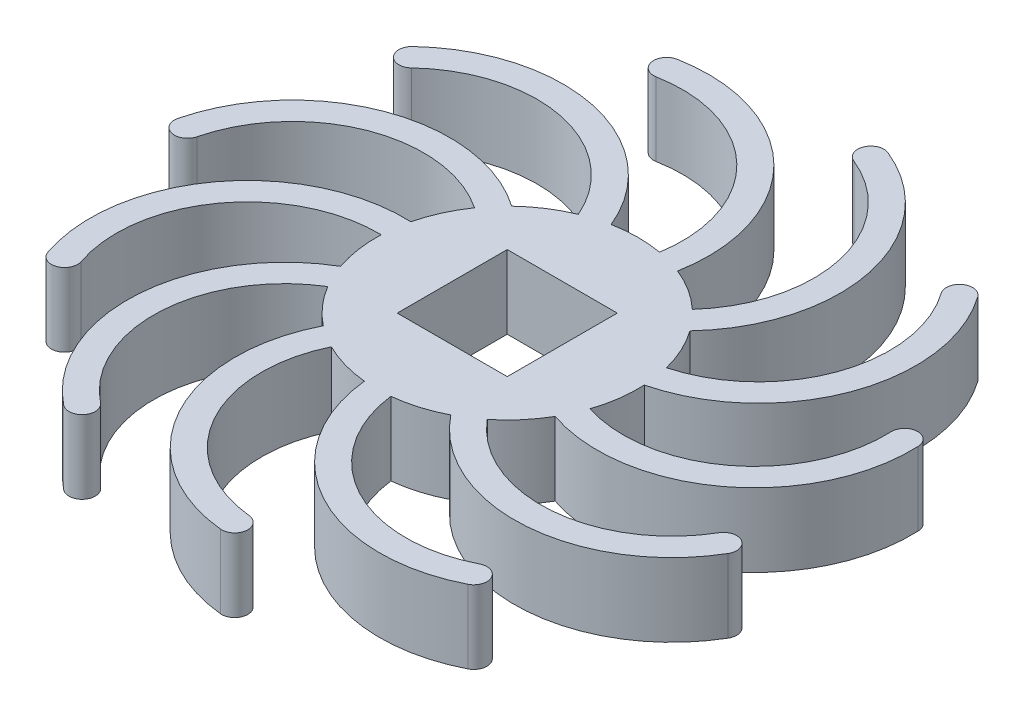
from build123d import *

# Parameters (mm, degrees)
SKETCH1_R           = 5
SKETCH1_W           = 4.2
SKETCH1_H           = 4.2
BOSS_EXTRUDE1_DEPTH = 2.8
BOSS_EXTRUDE5_DEPTH = 2.8


with BuildPart() as part:
    # Sketch1 → Boss-Extrude1 (new body)
    with BuildSketch(Plane(origin=(0, 0, 0), x_dir=(1, 0, 0), z_dir=(0, 1, 0))):
        Circle(SKETCH1_R)
        Rectangle(SKETCH1_W, SKETCH1_H, mode=Mode.SUBTRACT)
    extrude(amount=BOSS_EXTRUDE1_DEPTH)

    # Sketch2 → Boss-Extrude5 (add)
    with BuildSketch(Plane(origin=(0, 0, 0), x_dir=(1, 0, 0), z_dir=(0, 1, 0))):
        with BuildLine():
            ThreePointArc((-0.499297632, -4.680082759), (2.493631187, -9.560533326), (8.21668977, -9.712260432))
            ThreePointArc((8.21668977, -9.712260432), (8.43563539, -9.039904265), (7.763279223, -8.820958645))
            ThreePointArc((7.763279223, -8.820958645), (2.993631187, -8.694507923), (0.499297632, -4.627096918))
            ThreePointArc((0.499297632, -4.627096918), (-0.026492921, -4.154292207), (-0.499297632, -4.680082759))
        make_face()
        with BuildLine():
            ThreePointArc((-2.081561563, -4.162502309), (-2.182203058, -8.932764718), (1.76191578, -11.617808248))
            ThreePointArc((1.76191578, -11.617808248), (2.209166842, -12.165500212), (1.661474878, -12.612751274))
            ThreePointArc((1.661474878, -12.612751274), (-3.071038507, -9.39099124), (-2.950279665, -3.667195475))
            ThreePointArc((-2.950279665, -3.667195475), (-2.268267198, -3.480489841), (-2.081561563, -4.162502309))
        make_face()
        with BuildLine():
            ThreePointArc((-4.00153967, -2.376342627), (-6.665203252, -6.334931832), (-4.798843474, -10.72608582))
            ThreePointArc((-4.798843474, -10.72608582), (-4.718696569, -11.428635799), (-5.421246548, -11.508782704))
            ThreePointArc((-5.421246548, -11.508782704), (-7.660675174, -6.239875789), (-4.464568751, -1.489999539))
            ThreePointArc((-4.464568751, -1.489999539), (-3.789882666, -1.701656543), (-4.00153967, -2.376342627))
        make_face()
        with BuildLine():
            ThreePointArc((-4.651057205, 0.164289048), (-9.032048507, -1.725802849), (-9.836003832, -6.428906931))
            ThreePointArc((-9.836003832, -6.428906931), (-10.14840716, -7.063260271), (-10.7827605, -6.750856943))
            ThreePointArc((-10.7827605, -6.750856943), (-9.818101601, -1.107643863), (-4.561388803, 1.160260723))
            ThreePointArc((-4.561388803, 1.160260723), (-4.108237166, 0.617440684), (-4.651057205, 0.164289048))
        make_face()
        with BuildLine():
            ThreePointArc((-3.82389694, 2.652760111), (-8.531282178, 3.431256344), (-11.750302471, -0.090595516))
            ThreePointArc((-11.750302471, -0.090595516), (-12.356070183, -0.455349514), (-12.720824181, 0.150418198))
            ThreePointArc((-12.720824181, 0.150418198), (-8.858350142, 4.376257163), (-3.21000014, 3.442146403))
            ThreePointArc((-3.21000014, 3.442146403), (-3.122255393, 2.740504857), (-3.82389694, 2.652760111))
        make_face()
        with BuildLine():
            ThreePointArc((-1.782676415, 4.298998582), (-5.321894037, 7.498915892), (-9.933963099, 6.276479335))
            ThreePointArc((-9.933963099, 6.276479335), (-10.640768227, 6.297131497), (-10.620116065, 7.003936625))
            ThreePointArc((-10.620116065, 7.003936625), (-5.086135102, 8.470727461), (-0.839459112, 4.631174922))
            ThreePointArc((-0.839459112, 4.631174922), (-1.144979594, 3.993478101), (-1.782676415, 4.298998582))
        make_face()
        with BuildLine():
            ThreePointArc((0.824531276, 4.580335379), (-0.422842142, 9.185722629), (-4.963660634, 10.650816345))
            ThreePointArc((-4.963660634, 10.650816345), (-5.547097542, 11.050317751), (-5.147596136, 11.63375466))
            ThreePointArc((-5.147596136, 11.63375466), (0.300891896, 9.875801641), (1.797604251, 4.349838125))
            ThreePointArc((1.797604251, 4.349838125), (1.195819136, 3.978550264), (0.824531276, 4.580335379))
        make_face()
        with BuildLine():
            ThreePointArc((3.169956112, 3.407448056), (4.610459145, 7.956127335), (1.582569011, 11.64359442))
            ThreePointArc((1.582569011, 11.64359442), (1.307737418, 12.295106197), (1.959249194, 12.569937791))
            ThreePointArc((1.959249194, 12.569937791), (5.592387843, 8.145378579), (3.863940967, 2.687458458))
            ThreePointArc((3.863940967, 2.687458458), (3.15695374, 2.70046083), (3.169956112, 3.407448056))
        make_face()
        with BuildLine():
            ThreePointArc((4.508942281, 1.152720051), (8.17997223, 4.200517827), (7.626344177, 8.939613537))
            ThreePointArc((7.626344177, 8.939613537), (7.747374987, 9.636285298), (8.444046749, 9.515254488))
            ThreePointArc((8.444046749, 9.515254488), (9.108340163, 3.828855371), (4.703503727, 0.171829719))
            ThreePointArc((4.703503727, 0.171829719), (4.115777838, 0.564994163), (4.508942281, 1.152720051))
        make_face()
        with BuildLine():
            ThreePointArc((4.416371134, -1.467988425), (9.152401929, -0.888726412), (11.248808952, 3.39736852))
            ThreePointArc((11.248808952, 3.39736852), (11.727275739, 3.918011904), (12.247919124, 3.439545117))
            ThreePointArc((12.247919124, 3.439545117), (9.732458838, -1.703302364), (4.049737286, -2.398353741))
            ThreePointArc((4.049737286, -2.398353741), (3.767871552, -1.749854159), (4.416371134, -1.467988425))
        make_face()
        with BuildLine():
            ThreePointArc((2.921633357, -3.622620949), (7.219008683, -5.695806294), (11.299856365, -3.223516998))
            ThreePointArc((11.299856365, -3.223516998), (11.983849305, -3.044202586), (12.163163716, -3.728195526))
            ThreePointArc((12.163163716, -3.728195526), (7.266590599, -6.694673633), (2.110207872, -4.207076835))
            ThreePointArc((2.110207872, -4.207076835), (2.223692671, -3.50913615), (2.921633357, -3.622620949))
        make_face()
    extrude(amount=BOSS_EXTRUDE5_DEPTH)


solid = part.part
